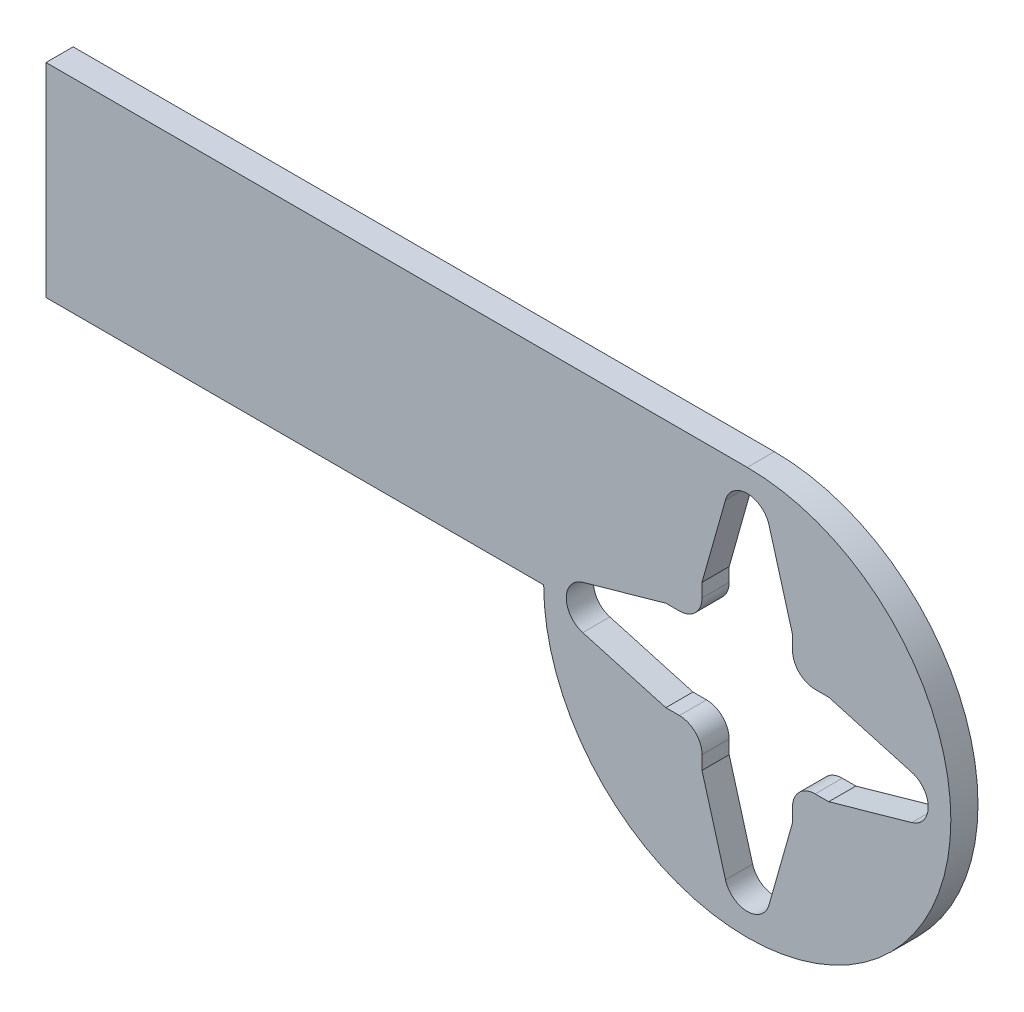
from build123d import *

# Parameters (mm, degrees)
BOSS_EXTRUDE1_DEPTH = 3


with BuildPart() as part:
    # Sketch1 → Boss-Extrude1 (new body)
    with BuildSketch(Plane.XY):
        with BuildLine():
            Line((0, 22.5), (-77.5, 22.5))
            Line((-77.5, 22.5), (-77.5, 0))
            Line((-77.5, 0), (-22.5, 0))
            ThreePointArc((-22.5, 0), (15.909902577, -15.909902577), (0, 22.5))
        make_face()
        with BuildLine():
            ThreePointArc((-7.5, 5), (-5.732233047, 5.732233047), (-5, 7.5))
            Line((-5, 7.5), (-5, 9))
            Line((-5, 9), (-2.405779746, 18.179870439))
            ThreePointArc((-2.405779746, 18.179870439), (0, 20), (2.405779746, 18.179870439))
            Line((2.405779746, 18.179870439), (5, 9))
            Line((5, 9), (5, 7.5))
            ThreePointArc((5, 7.5), (5.732233047, 5.732233047), (7.5, 5))
            Line((7.5, 5), (9, 5))
            Line((9, 5), (18.179870439, 2.405779746))
            ThreePointArc((18.179870439, 2.405779746), (20, 0), (18.179870439, -2.405779746))
            Line((18.179870439, -2.405779746), (9, -5))
            Line((9, -5), (7.5, -5))
            ThreePointArc((7.5, -5), (5.732233047, -5.732233047), (5, -7.5))
            Line((5, -7.5), (5, -9))
            Line((5, -9), (2.405779746, -18.179870439))
            ThreePointArc((2.405779746, -18.179870439), (0, -20), (-2.405779746, -18.179870439))
            Line((-2.405779746, -18.179870439), (-5, -9))
            Line((-5, -9), (-5, -7.5))
            ThreePointArc((-5, -7.5), (-5.732233047, -5.732233047), (-7.5, -5))
            Line((-7.5, -5), (-9, -5))
            Line((-9, -5), (-18.179870439, -2.405779746))
            ThreePointArc((-18.179870439, -2.405779746), (-20, 0), (-18.179870439, 2.405779746))
            Line((-18.179870439, 2.405779746), (-9, 5))
            Line((-9, 5), (-7.5, 5))
        make_face(mode=Mode.SUBTRACT)
    extrude(amount=BOSS_EXTRUDE1_DEPTH)


solid = part.part
